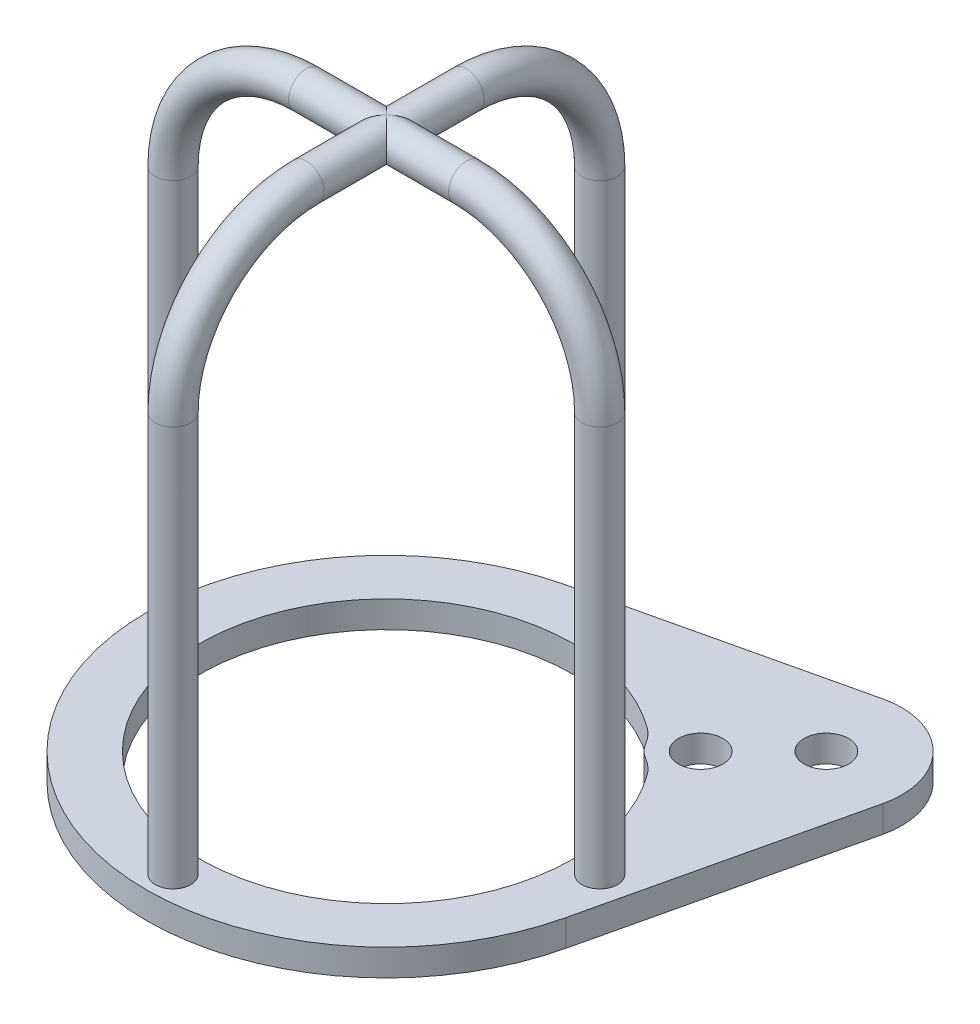
from build123d import *

# Parameters (mm, degrees)
ESQUISSE2_R                  = 2
R_P_TITION_CIRCULAIRE1_COUNT = 4
ESQUISSE4_R                  = 2.5
BOSS_EXTRU_1_DEPTH           = 3
CONG_1_R                     = 5


with BuildPart() as part:
    # Balayage1: sweep along a path in Esquisse1
    with BuildLine(Plane.XY) as balayage1_path:
        Line((0, 60), (9, 60))
        ThreePointArc((9, 60), (19.606601718, 55.606601718), (24, 45))
        Line((24, 45), (24, 0))
    # Esquisse2 → Balayage1 (sweep)
    with BuildSketch(Plane(origin=(0, 0, 0), x_dir=(1, 0, 0), z_dir=(0, 1, 0))):
        with Locations((24, 0)):
            Circle(ESQUISSE2_R)
    balayage1 = sweep(path=balayage1_path.line)

    # Répétition circulaire1: Balayage1 ×4 about axis
    r_p_tition_circulaire1_axis = Axis((0, 0, 0), (0, 1, 0))
    for i in range(1, R_P_TITION_CIRCULAIRE1_COUNT):
        add(balayage1.rotate(r_p_tition_circulaire1_axis, i * 360 / R_P_TITION_CIRCULAIRE1_COUNT))

    # Esquisse4 → Boss.-Extru.1 (add)
    with BuildSketch(Plane.XZ):
        with BuildLine():
            Line((26.298310212, 6.115462371), (33.027835001, -22.823499188))
            ThreePointArc((33.027835001, -22.823499188), (30.759144982, -30.759144982), (22.823499188, -33.027835001))
            Line((22.823499188, -33.027835001), (-6.115462371, -26.298310212))
            ThreePointArc((-6.115462371, -26.298310212), (-19.091883092, 19.091883092), (26.298310212, 6.115462371))
        make_face()
        with Locations((17.67766953, -17.67766953)):
            Circle(ESQUISSE4_R, mode=Mode.SUBTRACT)
        with Locations((24.748737342, -24.748737342)):
            Circle(ESQUISSE4_R, mode=Mode.SUBTRACT)
        with BuildLine():
            ThreePointArc((13.454452036, -16.123824621), (14.495689014, -14.495689014), (16.123824621, -13.454452036))
            ThreePointArc((16.123824621, -13.454452036), (-14.849242405, 14.849242405), (13.454452036, -16.123824621))
        make_face(mode=Mode.SUBTRACT)
    extrude(amount=BOSS_EXTRU_1_DEPTH)

    # Congé1
    cong_1_edges = [part.edges().sort_by_distance(p)[0] for p in [
        (16.123824621, -1.5, -13.454452036),
        (13.454452036, -1.5, -16.123824621),
    ]]
    fillet(cong_1_edges, radius=CONG_1_R)


solid = part.part
